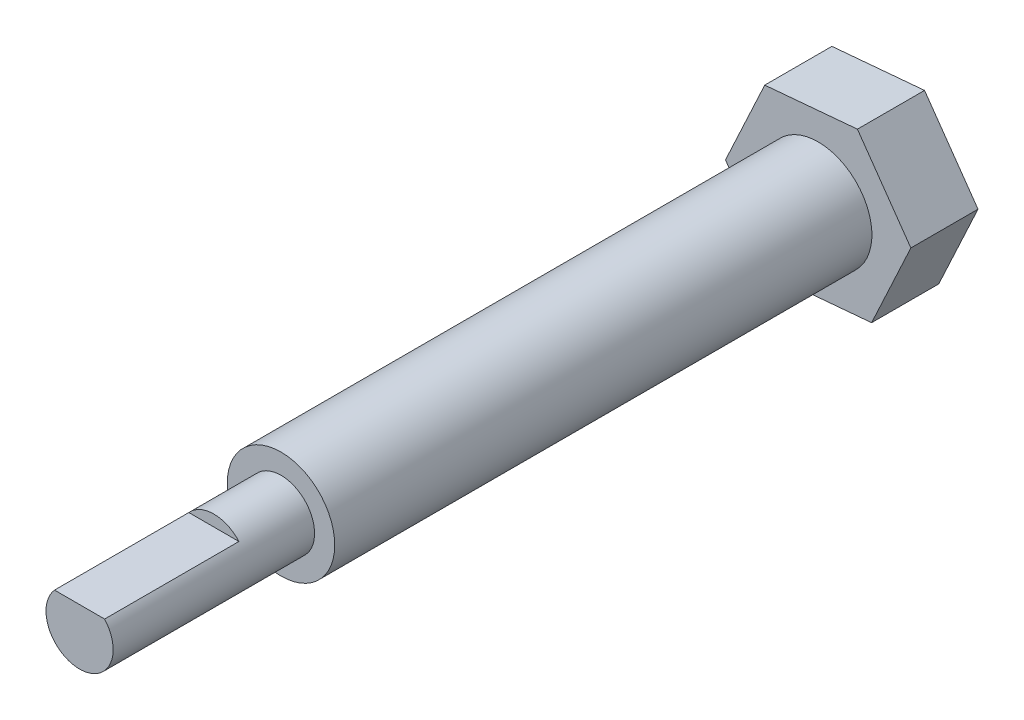
from build123d import *

# Parameters (mm, degrees)
SKETCH1_R           = 19.05
BOSS_EXTRUDE1_DEPTH = 50.8
SKETCH2_R           = 3.175
BOSS_EXTRUDE2_DEPTH = 19.05
SKETCH3_W           = 7.575380866
SKETCH3_H           = 1.446687318
CUT_EXTRUDE1_DEPTH  = 12.7
SKETCH4_R           = 19.824400573
CUT_EXTRUDE2_DEPTH  = 50.8
SKETCH5_R           = 5.08
BOSS_EXTRUDE3_DEPTH = 50.8
BOSS_EXTRUDE4_DEPTH = 6.35


with BuildPart() as part:
    # Sketch1 → Boss-Extrude1 (new body)
    with BuildSketch(Plane.XY):
        Circle(SKETCH1_R)
    extrude(amount=BOSS_EXTRUDE1_DEPTH)

    # Sketch2 → Boss-Extrude2 (add)
    with BuildSketch(Plane.XY.offset(50.8)):
        Circle(SKETCH2_R)
    extrude(amount=BOSS_EXTRUDE2_DEPTH)

    # Sketch3 → Cut-Extrude1 (cut)
    with BuildSketch(Plane.XY.offset(69.85)):
        with Locations((0.155919731, 2.835726074)):
            Rectangle(SKETCH3_W, SKETCH3_H)
    extrude(amount=-CUT_EXTRUDE1_DEPTH, mode=Mode.SUBTRACT)

    # Sketch4 → Cut-Extrude2 (cut)
    with BuildSketch(Plane(origin=(0, 0, 0), x_dir=(-1, 0, 0), z_dir=(0, 0, -1))):
        Circle(SKETCH4_R)
    extrude(amount=-CUT_EXTRUDE2_DEPTH, mode=Mode.SUBTRACT)

    # Sketch5 → Boss-Extrude3 (add)
    with BuildSketch(Plane.XY):
        Circle(SKETCH5_R)
    extrude(amount=BOSS_EXTRUDE3_DEPTH)

    # Sketch6 → Boss-Extrude4 (add)
    with BuildSketch(Plane(origin=(0, 0, 0), x_dir=(-1, 0, 0), z_dir=(0, 0, -1))):
        Polygon((3.711053278, -7.977924766), (8.764612156, -0.775095969), (5.053558878, 7.202828796), (-3.711053278, 7.977924766), (-8.764612156, 0.775095969), (-5.053558878, -7.202828796), align=None)
    extrude(amount=BOSS_EXTRUDE4_DEPTH)


solid = part.part
